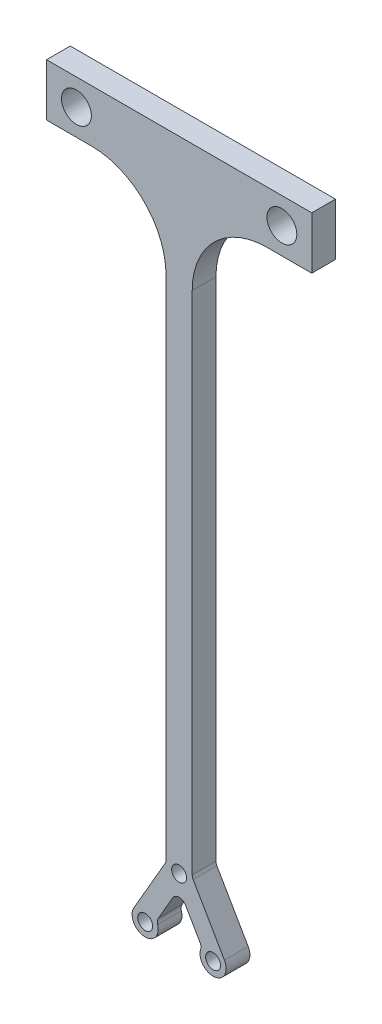
from build123d import *

# Parameters (mm, degrees)
SKETCH1_R           = 1
SKETCH1_R_2         = 2
BOSS_EXTRUDE1_DEPTH = 3.175


with BuildPart() as part:
    # Sketch1 → Boss-Extrude1 (new body)
    with BuildSketch(Plane.XY):
        with BuildLine():
            Line((1.75, 90.718911087), (17.75, 90.718911087))
            Line((17.75, 90.718911087), (17.75, 83.718911087))
            Line((17.75, 83.718911087), (11.75, 83.718911087))
            ThreePointArc((11.75, 83.718911087), (4.678932188, 80.789978899), (1.75, 73.718911087))
            Line((1.75, 73.718911087), (1.75, 5.986860279))
            ThreePointArc((1.75, 5.986860279), (1.784074174, 5.728041234), (1.883974596, 5.486860279))
            Line((1.883974596, 5.486860279), (6.062177826, -1.75))
            ThreePointArc((6.062177826, -1.75), (4.744524835, -4.363775134), (2.873226135, -2.112937283))
            ThreePointArc((2.873226135, -2.112937283), (2.91057922, -1.707249179), (2.783018833, -1.320330017))
            Line((2.783018833, -1.320330017), (0.866025404, 2))
            ThreePointArc((0.866025404, 2), (0, 2.5), (-0.866025404, 2))
            Line((-0.866025404, 2), (-2.783018833, -1.320330017))
            ThreePointArc((-2.783018833, -1.320330017), (-2.91057922, -1.707249179), (-2.873226135, -2.112937283))
            ThreePointArc((-2.873226135, -2.112937283), (-4.744524835, -4.363775134), (-6.062177826, -1.75))
            Line((-6.062177826, -1.75), (-1.883974596, 5.486860279))
            ThreePointArc((-1.883974596, 5.486860279), (-1.784074174, 5.728041234), (-1.75, 5.986860279))
            Line((-1.75, 5.986860279), (-1.75, 73.718911087))
            ThreePointArc((-1.75, 73.718911087), (-4.678932188, 80.789978899), (-11.75, 83.718911087))
            Line((-11.75, 83.718911087), (-17.75, 83.718911087))
            Line((-17.75, 83.718911087), (-17.75, 90.718911087))
            Line((-17.75, 90.718911087), (-1.75, 90.718911087))
            Line((-1.75, 90.718911087), (1.75, 90.718911087))
        make_face()
        with Locations((0, 5.25)):
            Circle(SKETCH1_R, mode=Mode.SUBTRACT)
        with Locations((-4.54663337, -2.625)):
            Circle(SKETCH1_R, mode=Mode.SUBTRACT)
        with Locations((4.54663337, -2.625)):
            Circle(SKETCH1_R, mode=Mode.SUBTRACT)
        with Locations((-13.75, 87.218911087)):
            Circle(SKETCH1_R_2, mode=Mode.SUBTRACT)
        with Locations((13.75, 87.218911087)):
            Circle(SKETCH1_R_2, mode=Mode.SUBTRACT)
    extrude(amount=BOSS_EXTRUDE1_DEPTH)


solid = part.part
